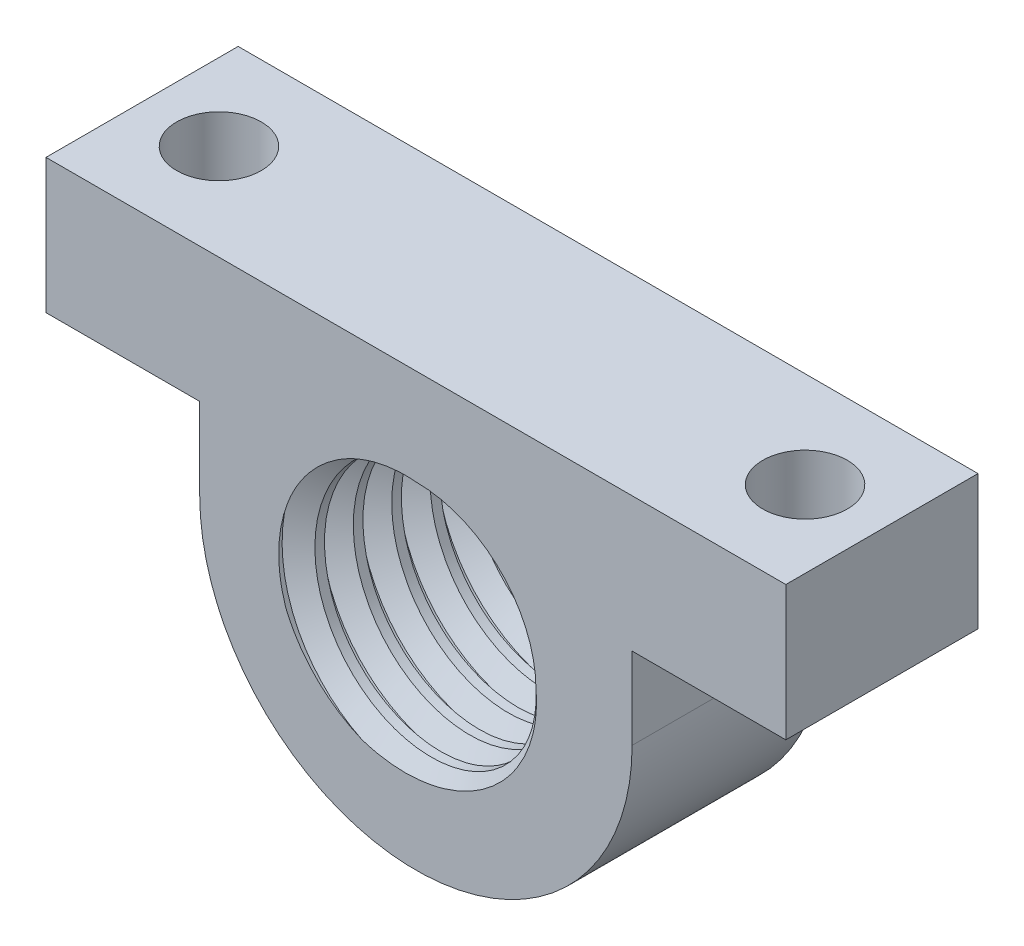
from build123d import *

# Parameters (mm, degrees)
SKIZZE1_R                       = 6.25
AUFSATZ_LINEAR_AUSTRAGEN1_DEPTH = 10
SKIZZE2_W                       = 8
SKIZZE2_H                       = 10
AUFSATZ_LINEAR_AUSTRAGEN2_DEPTH = 7
GEWINDE1_PITCH                  = 2
SKIZZE5_R                       = 2.2
SCHNITT_LINEAR_AUSTRAGEN1_DEPTH = 27.661067288


with BuildPart() as part:
    # Skizze1 → Aufsatz-Linear austragen1 (new body)
    with BuildSketch(Plane.XY):
        with BuildLine():
            Line((-11.25, 0), (-11.25, 11.25))
            Line((-11.25, 11.25), (0, 11.25))
            Line((0, 11.25), (11.25, 11.25))
            Line((11.25, 11.25), (11.25, 0))
            ThreePointArc((11.25, 0), (0, -11.25), (-11.25, 0))
        make_face()
        Circle(SKIZZE1_R, mode=Mode.SUBTRACT)
    extrude(amount=AUFSATZ_LINEAR_AUSTRAGEN1_DEPTH)

    # Skizze2 → Aufsatz-Linear austragen2 (add)
    with BuildSketch(Plane(origin=(0, 11.25, 0), x_dir=(1, 0, 0), z_dir=(0, 1, 0))):
        with Locations((15.25, -5)):
            Rectangle(SKIZZE2_W, SKIZZE2_H)
        with Locations((-15.25, -5)):
            Rectangle(SKIZZE2_W, SKIZZE2_H)
    extrude(amount=-AUFSATZ_LINEAR_AUSTRAGEN2_DEPTH)

    # Gewinde1: the profile of Gewindeprofil1 profile screwed along a right-hand helix of 7.5 turns, 10 arcs to a turn; built about Z, then put on its axis
    gewinde1_z = Axis((0, 0, 0), (0, 0, 1))
    gewinde1_corners = [(6.2497, 0, -0.000173205), (7.33253175, 0, 0.624999997), (7.33253175, 0, 0.874999997), (6.2497, 0, 1.5001732)]
    with BuildLine(mode=Mode.PRIVATE) as gewinde1_profile:
        Line(gewinde1_corners[0], gewinde1_corners[1])
        Line(gewinde1_corners[1], gewinde1_corners[2])
        Line(gewinde1_corners[2], gewinde1_corners[3])
        Line(gewinde1_corners[3], gewinde1_corners[0])
    gewinde1_cap = Face(gewinde1_profile.wire())
    gewinde1_turn_angles = [0, 18, 36, 54, 72, 90, 108, 126, 144, 162, 180, 198, 216, 234, 252, 270, 288, 306, 324, 342, 360]
    gewinde1_turn_weights = [1, 0.9510565162951535, 1, 0.9510565162951535, 1, 0.9510565162951535, 1, 0.9510565162951535, 1, 0.9510565162951535, 1, 0.9510565162951535, 1, 0.9510565162951535, 1, 0.9510565162951535, 1, 0.9510565162951535, 1, 0.9510565162951535, 1]
    gewinde1_turn_rails = [Edge.make_bspline([Vector(p[0], p[1], 0).rotate(gewinde1_z, gewinde1_turn_angles[k]) / gewinde1_turn_weights[k] + Vector(0, 0, p[2] + GEWINDE1_PITCH * gewinde1_turn_angles[k] / 360) for k in range(21)], [0, 0, 0, 1, 1, 2, 2, 3, 3, 4, 4, 5, 5, 6, 6, 7, 7, 8, 8, 9, 9, 10, 10, 10], 2, gewinde1_turn_weights) for p in gewinde1_corners]
    gewinde1_turn_sides = [Face.make_surface_from_curves(gewinde1_turn_rails[p[0]], gewinde1_turn_rails[p[1]]) for p in [(0, 1), (1, 2), (2, 3), (3, 0)]]
    gewinde1_last_angles = [2520, 2538, 2556, 2574, 2592, 2610, 2628, 2646, 2664, 2682, 2700]
    gewinde1_last_weights = [1, 0.9510565162951535, 1, 0.9510565162951535, 1, 0.9510565162951535, 1, 0.9510565162951535, 1, 0.9510565162951535, 1]
    gewinde1_last_rails = [Edge.make_bspline([Vector(p[0], p[1], 0).rotate(gewinde1_z, gewinde1_last_angles[k]) / gewinde1_last_weights[k] + Vector(0, 0, p[2] + GEWINDE1_PITCH * gewinde1_last_angles[k] / 360) for k in range(11)], [0, 0, 0, 1, 1, 2, 2, 3, 3, 4, 4, 5, 5, 5], 2, gewinde1_last_weights) for p in gewinde1_corners]
    gewinde1_last_sides = [Face.make_surface_from_curves(gewinde1_last_rails[p[0]], gewinde1_last_rails[p[1]]) for p in [(0, 1), (1, 2), (2, 3), (3, 0)]]
    gewinde1 = Plane(origin=(0, 0, -2), x_dir=(1, 0, 0), z_dir=(0, 0, 1)) * Solid(Shell([*[p.moved(Location((0, 0, GEWINDE1_PITCH * i))) for i in range(7) for p in gewinde1_turn_sides], *gewinde1_last_sides, gewinde1_cap, gewinde1_cap.rotate(gewinde1_z, 2700).moved(Location((0, 0, GEWINDE1_PITCH * 2700 / 360)))]))
    add(gewinde1, mode=Mode.SUBTRACT)

    # Skizze5 → Schnitt-Linear austragen1 (cut, through all)
    with BuildSketch(Plane.XZ.offset(-4.25)):
        with Locations(Location((15.25, 5, 0), (0, 0, 270))):
            Circle(SKIZZE5_R)
        with Locations(Location((-15.25, 5, 0), (0, 0, 90))):
            Circle(SKIZZE5_R)
    extrude(amount=-SCHNITT_LINEAR_AUSTRAGEN1_DEPTH, mode=Mode.SUBTRACT)


solid = part.part
